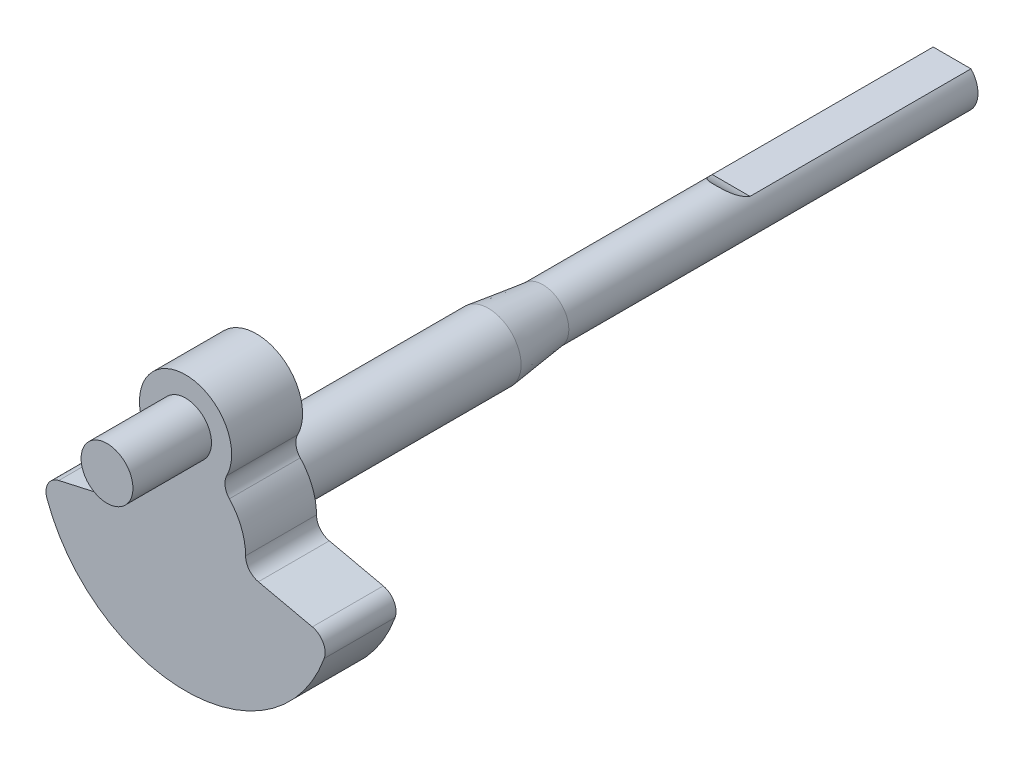
from build123d import *

# Parameters (mm, degrees)
SKETCH1_R                = 6
SKETCH1_R_2              = 4.75
BOSS_EXTRUDE1_DEPTH      = 13
BOSS_EXTRUDE2_DEPTH      = 14.4
BOSS_EXTRUDE2_DEPTH_BACK = 13
SKETCH2_R                = 4.75
BOSS_EXTRUDE3_START      = -55.5
SKETCH3_R                = 6
BOSS_EXTRUDE3_DEPTH      = 55.5
SKETCH4_R                = 4.75
BOSS_EXTRUDE4_DEPTH      = 85
CHAMFER1_SIZE2           = 10
CHAMFER1_SIZE            = 1.25
CUT_EXTRUDE1_DEPTH       = 15
CUT_EXTRUDE1_DEPTH_BACK  = 15


with BuildPart() as part:
    # Sketch1 → Boss-Extrude1 (new body)
    with BuildSketch(Plane.XY):
        with BuildLine():
            Line((-23.236982917, -5.200252391), (-13.344706072, -2.986439328))
            ThreePointArc((-13.344706072, -2.986439328), (-11.654410969, -1.929360589), (-10.999902799, -0.046242948))
            ThreePointArc((-10.999902799, -0.046242948), (-10.237754277, 4.023479509), (-8.025101164, 7.5231477))
            ThreePointArc((-8.025101164, 7.5231477), (-7.243992277, 9.150122037), (-7.537669453, 10.930832655))
            ThreePointArc((-7.537669453, 10.930832655), (0, 23.2), (7.537669453, 10.930832655))
            ThreePointArc((7.537669453, 10.930832655), (7.243992277, 9.150122037), (8.025101164, 7.5231477))
            ThreePointArc((8.025101164, 7.5231477), (10.237754277, 4.023479509), (10.999902799, -0.046242948))
            ThreePointArc((10.999902799, -0.046242948), (11.654410969, -1.929360589), (13.344706072, -2.986439328))
            Line((13.344706072, -2.986439328), (23.236982917, -5.200252391))
            ThreePointArc((23.236982917, -5.200252391), (25.210855565, -6.682799479), (25.404539286, -9.143816691))
            ThreePointArc((25.404539286, -9.143816691), (0, -27), (-25.404539286, -9.143816691))
            ThreePointArc((-25.404539286, -9.143816691), (-25.210855565, -6.682799479), (-23.236982917, -5.200252391))
        make_face()
        with Locations(Location((0, 0, 0), (0, 0, 180))):
            Circle(SKETCH1_R, mode=Mode.SUBTRACT)
        with Locations(Location((0, 14.75, 0), (0, 0, 180))):
            Circle(SKETCH1_R_2, mode=Mode.SUBTRACT)
    extrude(amount=BOSS_EXTRUDE1_DEPTH)

    # Sketch2 → Boss-Extrude2 (add, two sides: drawn at the far end of the back side and taken through both)
    with BuildSketch(Plane.XY.offset(13).offset(-BOSS_EXTRUDE2_DEPTH_BACK)):
        with Locations((0, 14.75)):
            Circle(SKETCH2_R)
    extrude(amount=BOSS_EXTRUDE2_DEPTH + BOSS_EXTRUDE2_DEPTH_BACK)

    # Sketch3 → Boss-Extrude3 (add)
    with BuildSketch(Plane.XY.offset(13).offset(BOSS_EXTRUDE3_START)):
        Circle(SKETCH3_R)
    extrude(amount=BOSS_EXTRUDE3_DEPTH)

    # Sketch4 → Boss-Extrude4 (add)
    with BuildSketch(Plane(origin=(0, 0, -42.5), x_dir=(-1, 0, 0), z_dir=(0, 0, -1))):
        Circle(SKETCH4_R)
    extrude(amount=BOSS_EXTRUDE4_DEPTH)

    # Chamfer1
    chamfer1_edges = [part.edges().sort_by_distance(p)[0] for p in [
        (4.75, 0, -42.5),
    ]]
    chamfer1_side = [part.faces().sort_by_distance(p)[0] for p in [
        (4.775, 0, -42.5),
    ]]
    chamfer(chamfer1_edges, length=CHAMFER1_SIZE - 0.0001, length2=CHAMFER1_SIZE2 - 0.0001, reference=chamfer1_side[0])  # a hair under: the kernel refuses the full size

    # Sketch5 → Cut-Extrude1 (cut, two sides: drawn at the far end of the back side and taken through both)
    with BuildSketch(Plane(origin=(0, 0, 0), x_dir=(0, 0, -1), z_dir=(1, 0, 0)).offset(-CUT_EXTRUDE1_DEPTH_BACK)):
        with BuildLine():
            Line((127.5, 3.25), (87, 3.25))
            ThreePointArc((87, 3.25), (83.953206786, 4.863584298), (81.962073187, 7.678187319))
            Line((81.962073187, 7.678187319), (127.5, 7.678187319))
            Line((127.5, 7.678187319), (127.5, 4.75))
            Line((127.5, 4.75), (127.5, 3.25))
        make_face()
    extrude(amount=CUT_EXTRUDE1_DEPTH + CUT_EXTRUDE1_DEPTH_BACK, mode=Mode.SUBTRACT)


solid = part.part
